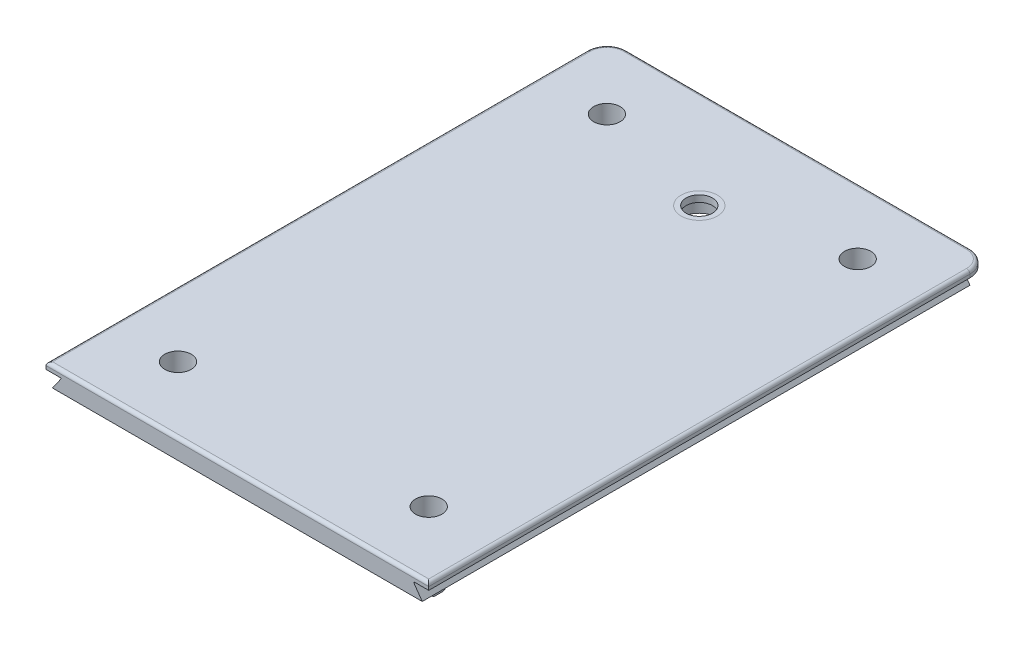
from build123d import *

# Parameters (mm, degrees)
BOSS_EXTRUDE1_DEPTH = 83
SKETCH3_W           = 58
SKETCH3_H           = 1
BOSS_EXTRUDE2_DEPTH = 2
FILLET1_R           = 3
SKETCH4_W           = 56.032437302
SKETCH4_H           = 2
BOSS_EXTRUDE3_DEPTH = 0.25
FILLET2_R           = 0.5
CUT_EXTRUDE1_REACH  = 91.868
SKETCH5_R           = 2.75
SKETCH6_R           = 2.75
SKETCH6_R_2         = 2
BOSS_EXTRUDE4_DEPTH = 1
SKETCH7_R           = 2
CUT_EXTRUDE2_DEPTH  = 2.95
FILLET3_R           = 0.5


with BuildPart() as part:
    # Sketch1 → Boss-Extrude1 (new body)
    with BuildSketch(Plane.XY):
        Polygon((-26.755845082, 29), (-28.016218651, 27.2), (28.016218651, 27.2), (26.755845082, 29), (26.755845082, 29.15), (29, 29.15), (29, 30.15), (-29, 30.15), (-29, 29.15), (-26.755845082, 29.15), align=None)
    extrude(amount=-BOSS_EXTRUDE1_DEPTH)

    # Sketch3 → Boss-Extrude2 (add)
    with BuildSketch(Plane(origin=(0, 0, -83), x_dir=(-1, 0, 0), z_dir=(0, 0, -1))):
        with Locations((0, 29.65)):
            Rectangle(SKETCH3_W, SKETCH3_H)
    extrude(amount=BOSS_EXTRUDE2_DEPTH)

    # Fillet1
    fillet1_edges = [part.edges().sort_by_distance(p)[0] for p in [
        (-29, 29.65, -85),
        (29, 29.65, -85),
    ]]
    fillet(fillet1_edges, radius=FILLET1_R)

    # Sketch4 → Boss-Extrude3 (add)
    with BuildSketch(Plane.XZ.offset(-27.2)):
        with Locations((0, -2.5)):
            Rectangle(SKETCH4_W, SKETCH4_H)
    extrude(amount=BOSS_EXTRUDE3_DEPTH)

    # Fillet2
    # the kernel refuses this fillet: 0.5 mm, written as the material it takes off along each edge
    with BuildSketch(Plane(origin=(-29.098750406, 26.95, -3.5), x_dir=(0, 1, 0), z_dir=(1, 0, 0)), Plane(origin=(29.098750406, 26.95, -1.5), x_dir=(0, 1, 0), z_dir=(-1, 0, 0))) as fillet2_piece_1:
        with BuildLine():
            CenterArc((0.5, 0.433012702), FILLET2_R, 180, 60)
            Line((0, 0.433012702), (-0.01, 0.433012702))
            Line((-0.01, 0.433012702), (-0.01, 0))
            Line((-0.01, 0), (0, -0.01))
            ThreePointArc((0, -0.01), (0.125, -0.01), (0.245, -0.008660254))
            Line((0.245, -0.008660254), (0.25, 0))
        make_face()
    extrude(amount=58.197500812, mode=Mode.SUBTRACT)

    # Sketch5 → Cut-Extrude1 (cut, up to next)
    with BuildSketch(Plane(origin=(0, 30.15, 0), x_dir=(1, 0, 0), z_dir=(0, 1, 0)), mode=Mode.PRIVATE) as cut_extrude1_sk1:
        with Locations(Location((0, 70, 0), (0, 0, 270))):
            Circle(SKETCH5_R)
    cut_extrude1_tool1 = extrude(cut_extrude1_sk1.sketch, amount=-CUT_EXTRUDE1_REACH, mode=Mode.PRIVATE) & part.part
    add(cut_extrude1_tool1.solids().sort_by_distance((0, 30.15, -70))[0], mode=Mode.SUBTRACT)

    # Sketch7 → Cut-Extrude2 (cut)
    with BuildSketch(Plane(origin=(0, 30.15, 0), x_dir=(1, 0, 0), z_dir=(0, 1, 0))):
        with Locations(Location((19, 10, 0), (0, 0, 270))):
            Circle(SKETCH7_R)
        with Locations((19, 75)):
            Circle(SKETCH7_R)
        with Locations(Location((-19, 75, 0), (0, 0, 270))):
            Circle(SKETCH7_R)
        with Locations((-19, 10)):
            Circle(SKETCH7_R)
    extrude(amount=-CUT_EXTRUDE2_DEPTH, mode=Mode.SUBTRACT)

    # Fillet3
    fillet3_edges = [part.edges().sort_by_distance(p)[0] for p in [
        (0, 30.15, 0),
        (29, 30.15, -41),
        (0, 30.15, -85),
        (-29, 30.15, -41),
        (-28.121320344, 30.15, -84.121320344),
        (28.121320344, 30.15, -84.121320344),
    ]]
    fillet(fillet3_edges, radius=FILLET3_R)


with BuildPart() as body_2:
    # Sketch6 → Boss-Extrude4 (new body)
    with BuildSketch(Plane(origin=(0, 30.15, 0), x_dir=(1, 0, 0), z_dir=(0, 1, 0))):
        with Locations(Location((0, 70, 0), (0, 0, 270))):
            Circle(SKETCH6_R)
        with Locations(Location((0, 70, 0), (0, 0, 270))):
            Circle(SKETCH6_R_2, mode=Mode.SUBTRACT)
    extrude(amount=-BOSS_EXTRUDE4_DEPTH)


solid = Compound([part.part, body_2.part])
